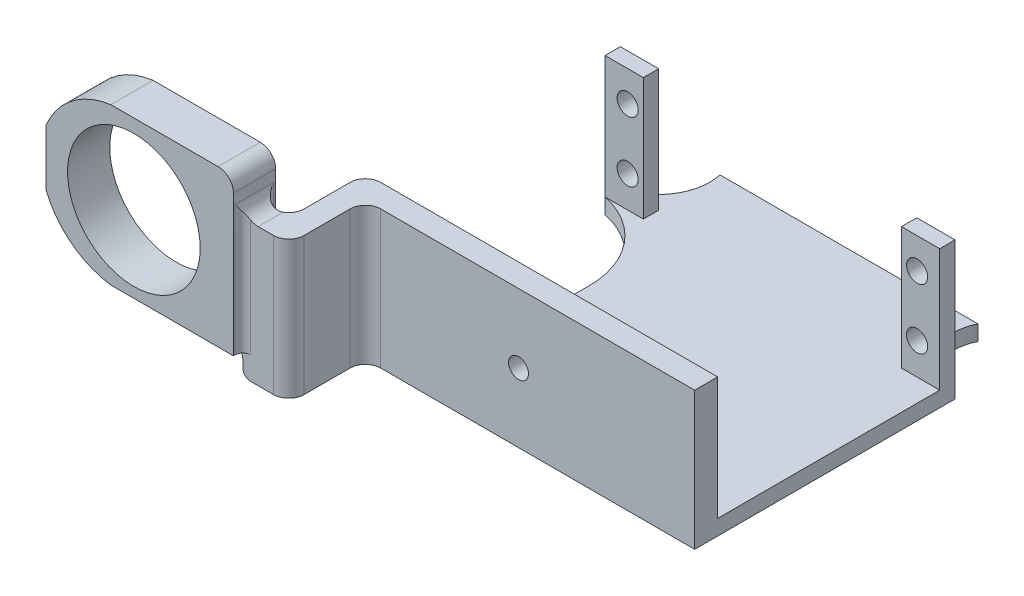
from build123d import *

# Parameters (mm, degrees)
SKETCH2_W            = 55.515999966
SKETCH2_H            = 31.75
BOSS_EXTRUDE1_DEPTH  = 2.54
SKETCH4_W            = 6.35
SKETCH4_H            = 2.54
BOSS_EXTRUDE7_DEPTH  = 22.86
SKETCH29_W           = 55.515999966
SKETCH29_H           = 2.54
BOSS_EXTRUDE12_DEPTH = 5.08
SKETCH31_W           = 3.81
SKETCH31_H           = 8.89
BOSS_EXTRUDE13_DEPTH = 22.86
SKETCH32_W           = 7
SKETCH32_H           = 25.908
BOSS_EXTRUDE14_DEPTH = 31.75
SKETCH33_R           = 1.65
CUT_EXTRUDE5_DEPTH   = 9.144
SKETCH36_R           = 1.75
CUT_EXTRUDE7_DEPTH   = 2.54
SKETCH37_W           = 42.8
SKETCH37_H           = 2.54
BOSS_EXTRUDE15_DEPTH = 12.7
SKETCH38_W           = 55.5
SKETCH38_H           = 2.54
BOSS_EXTRUDE16_DEPTH = 6.35
CUT_EXTRUDE19_DEPTH  = 17.78
FILLET9_R            = 2.54
FILLET11_R           = 2.54
FILLET12_R           = 2.54
FILLET13_R           = 2.54
SKETCH47_R           = 11
CUT_EXTRUDE21_DEPTH  = 7.112
FILLET17_R           = 1.27
FILLET18_R           = 1.27
FILLET19_R           = 2.54
CUT_EXTRUDE24_DEPTH  = 7.62
SKETCH52_W           = 0.667345496
SKETCH52_H           = 9.289885036
CUT_EXTRUDE25_DEPTH  = 7.62


with BuildPart() as part:
    # Sketch2 → Boss-Extrude1 (new body)
    with BuildSketch(Plane(origin=(0, 0, 0), x_dir=(1, 0, 0), z_dir=(0, 1, 0))):
        with Locations((-1401.125525756, 387.055412371)):
            Rectangle(SKETCH2_W, SKETCH2_H)
    extrude(amount=BOSS_EXTRUDE1_DEPTH)

    # Sketch4 → Boss-Extrude7 (add)
    with BuildSketch(Plane.XZ):
        with Locations((-1376.542525773, -404.200412371)):
            Rectangle(SKETCH4_W, SKETCH4_H)
        with Locations((-1425.692525773, -404.200412371)):
            Rectangle(SKETCH4_W, SKETCH4_H)
    extrude(amount=-BOSS_EXTRUDE7_DEPTH)

    # Sketch29 → Boss-Extrude12 (add)
    with BuildSketch(Plane.XY.offset(-371.180412371)):
        with Locations((-1401.125525756, 1.27)):
            Rectangle(SKETCH29_W, SKETCH29_H)
    extrude(amount=BOSS_EXTRUDE12_DEPTH)

    # Sketch31 → Boss-Extrude13 (add)
    with BuildSketch(Plane.XZ):
        Polygon((-1428.883525739, -366.100412371), (-1373.367525773, -366.100412371), (-1373.367525773, -362.290412371), (-1427.977525773, -362.290412371), (-1431.787525773, -362.290412371), (-1431.787525773, -366.100412371), align=None)
        with Locations((-1429.882525773, -357.845412371)):
            Rectangle(SKETCH31_W, SKETCH31_H)
        Polygon((-1431.787525773, -353.400412371), (-1427.977525773, -353.400412371), (-1427.977525773, -349.590412371), (-1435.597525773, -349.590412371), (-1435.597525773, -353.400412371), align=None)
    extrude(amount=-BOSS_EXTRUDE13_DEPTH)

    # Sketch32 → Boss-Extrude14 (add)
    with BuildSketch(Plane.ZY.offset(1435.597525773)):
        with Locations((-351.526012371, 16.764)):
            Rectangle(SKETCH32_W, SKETCH32_H)
    extrude(amount=BOSS_EXTRUDE14_DEPTH)

    # Sketch33 → Cut-Extrude5 (cut)
    with BuildSketch(Plane.XY.offset(-362.290412371)):
        with Locations((-1402.577525773, 11.43)):
            Circle(SKETCH33_R)
    extrude(amount=-CUT_EXTRUDE5_DEPTH, mode=Mode.SUBTRACT)

    # Sketch36 → Cut-Extrude7 (cut)
    with BuildSketch(Plane(origin=(0, 0, -405.470412371), x_dir=(-1, 0, 0), z_dir=(0, 0, -1))):
        with Locations((1425.117525773, 17.78)):
            Circle(SKETCH36_R)
        with Locations((1425.117525773, 7.78)):
            Circle(SKETCH36_R)
        with Locations((1377.117525773, 17.78)):
            Circle(SKETCH36_R)
        with Locations((1377.117525773, 7.78)):
            Circle(SKETCH36_R)
    extrude(amount=-CUT_EXTRUDE7_DEPTH, mode=Mode.SUBTRACT)

    # Sketch37 → Boss-Extrude15 (add)
    with BuildSketch(Plane(origin=(0, 0, -402.930412371), x_dir=(-1, 0, 0), z_dir=(0, 0, -1))):
        with Locations((1401.117525773, 1.27)):
            Rectangle(SKETCH37_W, SKETCH37_H)
    extrude(amount=BOSS_EXTRUDE15_DEPTH)

    # Sketch38 → Boss-Extrude16 (add)
    with BuildSketch(Plane(origin=(0, 0, -405.470412371), x_dir=(-1, 0, 0), z_dir=(0, 0, -1))):
        with Locations((1401.117525773, 1.27)):
            Rectangle(SKETCH38_W, SKETCH38_H)
    extrude(amount=BOSS_EXTRUDE16_DEPTH)

    # Sketch46 → Cut-Extrude19 (cut)
    with BuildSketch(Plane(origin=(0, 2.54, 0), x_dir=(1, 0, 0), z_dir=(0, 1, 0))):
        with BuildLine():
            Line((-1422.517525773, 415.630412371), (-1428.867525773, 415.630412371))
            Line((-1428.867525773, 415.630412371), (-1428.867525773, 405.470412371))
            ThreePointArc((-1428.867525773, 405.470412371), (-1423.588320876, 409.235284311), (-1422.517525773, 415.630412371))
        make_face()
        with BuildLine():
            Line((-1417.437071461, 366.100412371), (-1428.883525739, 366.100412371))
            Line((-1428.883525739, 366.100412371), (-1428.883525739, 402.930412371))
            ThreePointArc((-1428.883525739, 402.930412371), (-1420.659545742, 397.92062476), (-1417.437071461, 388.846073619))
            Line((-1417.437071461, 388.846073619), (-1417.437071461, 366.100412371))
        make_face()
        with BuildLine():
            Line((-1373.367525773, 405.470412371), (-1373.367525773, 415.630412371))
            Line((-1373.367525773, 415.630412371), (-1379.717525773, 415.630412371))
            ThreePointArc((-1379.717525773, 415.630412371), (-1379.413786034, 408.755874708), (-1373.367525773, 405.470412371))
        make_face()
    extrude(amount=-CUT_EXTRUDE19_DEPTH, mode=Mode.SUBTRACT)

    # Fillet9
    fillet9_edges = [part.edges().sort_by_distance(p)[0] for p in [
        (-1417.437071461, 1.27, -366.100412371),
    ]]
    fillet(fillet9_edges, radius=FILLET9_R)

    # Fillet11
    fillet11_edges = [part.edges().sort_by_distance(p)[0] for p in [
        (-1431.787525773, 11.43, -353.400412371),
    ]]
    fillet(fillet11_edges, radius=FILLET11_R)

    # Fillet12
    fillet12_edges = [part.edges().sort_by_distance(p)[0] for p in [
        (-1427.977525773, 11.43, -362.290412371),
    ]]
    fillet(fillet12_edges, radius=FILLET12_R)

    # Fillet13
    fillet13_edges = [part.edges().sort_by_distance(p)[0] for p in [
        (-1431.787525773, 11.43, -366.100412371),
        (-1427.977525773, 11.43, -349.590412371),
    ]]
    fillet(fillet13_edges, radius=FILLET13_R)

    # Sketch47 → Cut-Extrude21 (cut)
    with BuildSketch(Plane.XY.offset(-348.026012371)):
        with Locations((-1452.107525773, 16.51)):
            Circle(SKETCH47_R)
    extrude(amount=-CUT_EXTRUDE21_DEPTH, mode=Mode.SUBTRACT)

    # Fillet17
    fillet17_edges = [part.edges().sort_by_distance(p)[0] for p in [
        (-1435.597525773, 3.81, -351.495412371),
        (-1435.597525773, 0, -351.495412371),
    ]]
    fillet(fillet17_edges, radius=FILLET17_R)

    # Fillet18
    fillet18_edges = [part.edges().sort_by_distance(p)[0] for p in [
        (-1435.597525773, 13.335, -353.400412371),
        (-1435.597525773, 13.335, -349.590412371),
    ]]
    fillet(fillet18_edges, radius=FILLET18_R - 0.0001)  # a hair under: the kernel refuses the full size

    # Fillet19
    fillet19_edges = [part.edges().sort_by_distance(p)[0] for p in [
        (-1435.597525773, 29.718, -351.526012371),
        (-1435.597525773, 22.86, -351.495412371),
    ]]
    fillet(fillet19_edges, radius=FILLET19_R)

    # Sketch51 → Cut-Extrude24 (cut)
    with BuildSketch(Plane.XY.offset(-348.026012371)):
        with BuildLine():
            Line((-1467.347525773, 29.718), (-1467.347525773, 19.304))
            ThreePointArc((-1467.347525773, 19.304), (-1463.253192632, 26.289780699), (-1455.917525773, 29.718))
            Line((-1455.917525773, 29.718), (-1467.347525773, 29.718))
        make_face()
        with BuildLine():
            ThreePointArc((-1455.917525773, 3.81), (-1463.26939399, 7.220437323), (-1467.347525773, 14.224))
            Line((-1467.347525773, 14.224), (-1467.347525773, 3.81))
            Line((-1467.347525773, 3.81), (-1455.917525773, 3.81))
        make_face()
    extrude(amount=-CUT_EXTRUDE24_DEPTH, mode=Mode.SUBTRACT)

    # Sketch52 → Cut-Extrude25 (cut)
    with BuildSketch(Plane.XY.offset(-348.026012371)):
        with Locations((-1467.013853025, 16.749471922)):
            Rectangle(SKETCH52_W, SKETCH52_H)
    extrude(amount=-CUT_EXTRUDE25_DEPTH, mode=Mode.SUBTRACT)


solid = part.part
